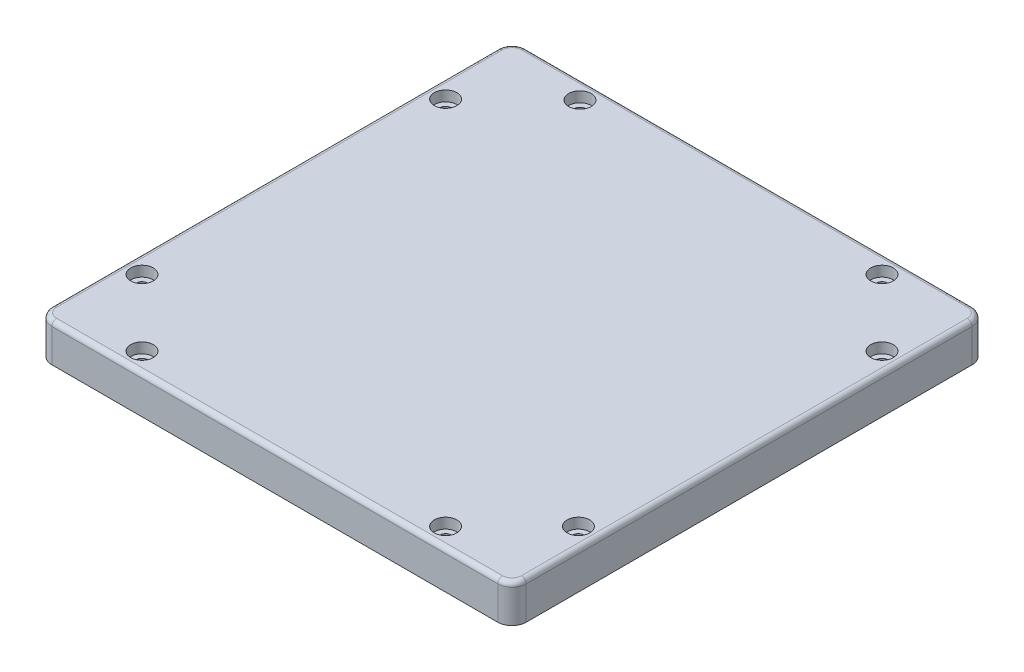
from build123d import *

# Parameters (mm, degrees)
SKETCH3_W                                      = 100
SKETCH3_H                                      = 100
BOSS_EXTRUDE2_DEPTH                            = 8
CBORE_FOR_2_SOCKET_HEAD_CAP_SCREW1_D           = 2.4384
CBORE_FOR_2_SOCKET_HEAD_CAP_SCREW1_CBORE_D     = 4.7625
CBORE_FOR_2_SOCKET_HEAD_CAP_SCREW1_CBORE_DEPTH = 2.1844
FILLET1_R                                      = 1
FILLET2_R                                      = 3
FILLET3_R                                      = 3


with BuildPart() as part:
    # Sketch3 → Boss-Extrude2 (new body)
    with BuildSketch(Plane(origin=(0, 0, 0), x_dir=(1, 0, 0), z_dir=(0, 1, 0))):
        Rectangle(SKETCH3_W, SKETCH3_H)
    extrude(amount=BOSS_EXTRUDE2_DEPTH)

    # CBORE for #2 Socket Head Cap Screw1 (through all)
    with Locations(Plane(origin=(-46, 8, 32), x_dir=(0, 0, 1), z_dir=(0, 1, 0))):
        with Locations((0, 0), (14, 14), (-64, 0), (-78, 14.320192801), (-78, 78), (-64, 92), (14, 78), (0, 92)):
            CounterBoreHole(CBORE_FOR_2_SOCKET_HEAD_CAP_SCREW1_D / 2, CBORE_FOR_2_SOCKET_HEAD_CAP_SCREW1_CBORE_D / 2, CBORE_FOR_2_SOCKET_HEAD_CAP_SCREW1_CBORE_DEPTH)

    # Fillet1
    fillet1_edges = [part.edges().sort_by_distance(p)[0] for p in [
        (-50, 8, 0),
        (0, 8, 50),
        (50, 8, 0),
        (0, 8, -50),
    ]]
    fillet(fillet1_edges, radius=FILLET1_R)

    # Fillet2
    # the kernel refuses this fillet: 3 mm, written as the material it takes off along each edge
    with BuildSketch(Plane(origin=(-47, 8, -47), x_dir=(0, 0, -1), z_dir=(1, 0, 0))) as fillet2_piece_1:
        with BuildLine():
            CenterArc((2, -1), 1, 0, 90)
            Line((3, -1), (3, 0))
            Line((3, 0), (2, 0))
        make_face()
    revolve(axis=Axis((-47, 8, -47), (0, 1, 0)), revolution_arc=90, mode=Mode.SUBTRACT)
    with BuildSketch(Plane(origin=(47, 8, -47), x_dir=(1, 0, 0), z_dir=(0, 0, 1))) as fillet2_piece_2:
        with BuildLine():
            CenterArc((2, -1), 1, 0, 90)
            Line((3, -1), (3, 0))
            Line((3, 0), (2, 0))
        make_face()
    revolve(axis=Axis((47, 8, -47), (0, 1, 0)), revolution_arc=90, mode=Mode.SUBTRACT)
    with BuildSketch(Plane(origin=(-47, 8, 47), x_dir=(-1, 0, 0), z_dir=(0, 0, -1))) as fillet2_piece_3:
        with BuildLine():
            CenterArc((2, -1), 1, 0, 90)
            Line((3, -1), (3, 0))
            Line((3, 0), (2, 0))
        make_face()
    revolve(axis=Axis((-47, 8, 47), (0, 1, 0)), revolution_arc=90, mode=Mode.SUBTRACT)
    with BuildSketch(Plane(origin=(-50, -7.5, 50), x_dir=(0, 0, -1), z_dir=(0, 1, 0)), Plane(origin=(-50, -7.5, -50), x_dir=(1, 0, 0), z_dir=(0, 1, 0))) as fillet2_piece_4:
        with BuildLine():
            CenterArc((FILLET2_R, -FILLET2_R), FILLET2_R, 90, 90)
            Line((0, -FILLET2_R), (0, 0))
            Line((0, 0), (FILLET2_R, 0))
        make_face()
    extrude(amount=15.5, mode=Mode.SUBTRACT)
    with BuildSketch(Plane(origin=(50, -7.5, -50), x_dir=(-1, 0, 0), z_dir=(0, 1, 0))) as fillet2_piece_5:
        with BuildLine():
            CenterArc((FILLET2_R, FILLET2_R), FILLET2_R, 180, 90)
            Line((0, FILLET2_R), (0, 0))
            Line((0, 0), (FILLET2_R, 0))
        make_face()
    extrude(amount=15.5, mode=Mode.SUBTRACT)

    # Fillet3
    # the kernel refuses this fillet: 3 mm, written as the material it takes off along each edge
    with BuildSketch(Plane(origin=(47, 8, 47), x_dir=(0, 0, 1), z_dir=(-1, 0, 0))) as fillet3_piece_1:
        with BuildLine():
            CenterArc((2, -1), 1, 0, 90)
            Line((3, -1), (3, 0))
            Line((3, 0), (2, 0))
        make_face()
    revolve(axis=Axis((47, 8, 47), (0, 1, 0)), revolution_arc=90, mode=Mode.SUBTRACT)
    with BuildSketch(Plane(origin=(50, -7.5, 50), x_dir=(-1, 0, 0), z_dir=(0, 1, 0))) as fillet3_piece_2:
        with BuildLine():
            CenterArc((FILLET3_R, -FILLET3_R), FILLET3_R, 90, 90)
            Line((0, -FILLET3_R), (0, 0))
            Line((0, 0), (FILLET3_R, 0))
        make_face()
    extrude(amount=15.5, mode=Mode.SUBTRACT)


solid = part.part
